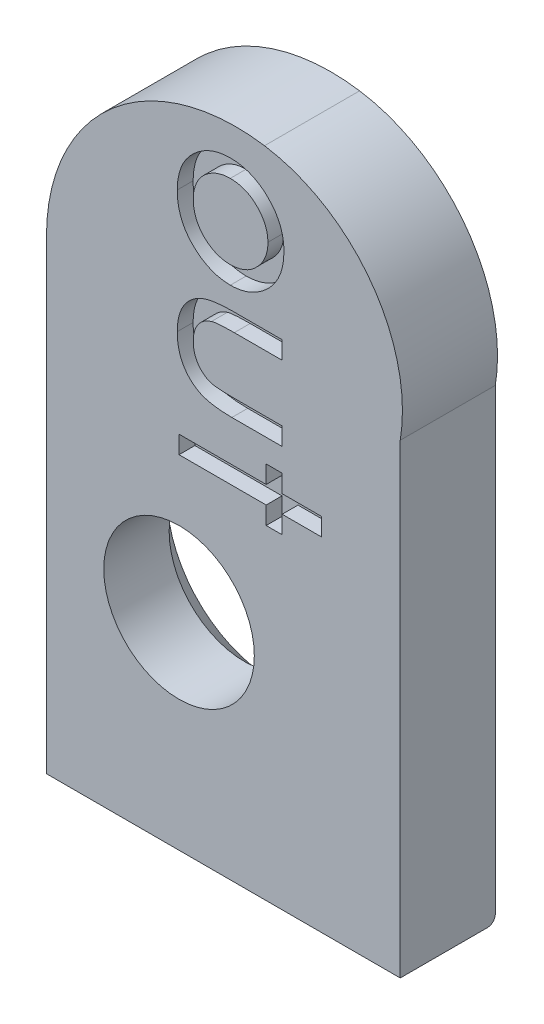
from build123d import *

# Parameters (mm, degrees)
BOSS_EXTRUDE1_DEPTH = 2.4
SKETCH3_R           = 1.9
CUT_EXTRUDE3_DEPTH  = 13.884062313
CHAMFER1_SIZE       = 0.75
CHAMFER1_SIZE2      = 0.804276533
FILLET1_R           = 0.2
CUT_EXTRUDE4_DEPTH  = 0.4
SCALE1_SCALE        = 1.15


with BuildPart() as part:
    # Sketch1 → Boss-Extrude1 (new body)
    with BuildSketch(Plane.XY):
        with BuildLine():
            Line((-3.345730544, 6.552967213), (-3.345730544, -5.2))
            Line((-3.345730544, -5.2), (5.58286968, -5.2))
            Line((5.58286968, -5.2), (5.58286968, 6.552967213))
            ThreePointArc((5.58286968, 6.552967213), (4.857648619, 9.631827975), (2.157036246, 11.27864976))
            ThreePointArc((2.157036246, 11.27864976), (-1.679748439, 10.179691557), (-3.345730544, 6.552967213))
        make_face()
    extrude(amount=BOSS_EXTRUDE1_DEPTH)

    # Sketch3 → Cut-Extrude3 (cut, through all)
    with BuildSketch(Plane.XY):
        Circle(SKETCH3_R)
    extrude(amount=CUT_EXTRUDE3_DEPTH, mode=Mode.SUBTRACT)

    # Chamfer1
    chamfer1_edges = [part.edges().sort_by_distance(p)[0] for p in [
        (-1.9, 0, 0),
    ]]
    chamfer1_side = [part.faces().sort_by_distance(p)[0] for p in [
        (-1.9, 0, 1.2),
    ]]
    chamfer(chamfer1_edges, length=CHAMFER1_SIZE, length2=CHAMFER1_SIZE2, reference=chamfer1_side[0])

    # Fillet1
    fillet1_edges = [part.edges().sort_by_distance(p)[0] for p in [
        (1.118569568, -5.2, 0),
    ]]
    fillet(fillet1_edges, radius=FILLET1_R)

    # Sketch4 → Cut-Extrude4 (cut)
    # profile 1 of 3: a face of its own
    with BuildSketch(Plane.XY.offset(2.4)):
        with BuildLine():
            add(Edge.make_bspline(
                [(2.647435897, 9.21132169), (2.646016509, 9.159380611), (2.643237615, 9.057689783), (2.623603841, 8.908908503), (2.589766857, 8.767767325), (2.542661084, 8.63377309), (2.482190193, 8.506964867), (2.408088648, 8.387623244), (2.320035473, 8.276135537), (2.252484203, 8.208992323), (2.218349359, 8.175063677)],
                knots=[0, 0, 0, 0, 1.078802918, 2.112092493, 3.110573245, 4.088605452, 5.057036471, 6.022908947, 7.000941154, 8, 8, 8, 8], degree=3))
            add(Edge.make_bspline(
                [(2.218349359, 8.175063677), (2.184569367, 8.144899917), (2.118256635, 8.085686126), (2.010267576, 8.010306009), (1.900593289, 7.944088166), (1.786009732, 7.891762285), (1.668525675, 7.849338093), (1.54669492, 7.821707997), (1.421818335, 7.801898341), (1.337120039, 7.800147933), (1.294270833, 7.799262395)],
                knots=[0, 0, 0, 0, 1.062297535, 2.08537206, 3.086585084, 4.066078755, 5.037873789, 6.013379158, 6.994960584, 8, 8, 8, 8], degree=3))
            add(Edge.make_bspline(
                [(1.294270833, 7.799262395), (1.251202095, 7.80049602), (1.165845843, 7.802940892), (1.039756461, 7.821865609), (0.917025605, 7.851795394), (0.798213576, 7.894850209), (0.683191461, 7.95026075), (0.571259587, 8.01673651), (0.463907741, 8.096884941), (0.360824663, 8.186999842), (0.265726104, 8.287143015), (0.182468224, 8.396432417), (0.112009898, 8.513528248), (0.054012972, 8.638219072), (0.010188539, 8.771099555), (-0.022266192, 8.910882456), (-0.041432806, 9.058646195), (-0.04370713, 9.159615844), (-0.044871795, 9.21132169)],
                knots=[0, 0, 0, 0, 0.952871876, 1.888459614, 2.815544184, 3.744891397, 4.679563604, 5.637601804, 6.621431805, 7.640342292, 8.664856555, 9.672479278, 10.67487095, 11.683873433, 12.709444777, 13.765907845, 14.855937143, 16, 16, 16, 16], degree=3))
            add(Edge.make_bspline(
                [(-0.044871795, 9.21132169), (-0.043737537, 9.26070302), (-0.041514065, 9.357504723), (-0.021776537, 9.498962474), (0.008349879, 9.633849602), (0.053152229, 9.761197562), (0.109237379, 9.88200012), (0.17848455, 9.995494765), (0.26029152, 10.101970877), (0.354052874, 10.199876499), (0.455511014, 10.288907022), (0.562416146, 10.367214389), (0.673804765, 10.433670746), (0.789563416, 10.487861182), (0.910007707, 10.529332731), (1.034080697, 10.559712138), (1.162884473, 10.577449191), (1.25004648, 10.5800129), (1.294270833, 10.581313677)],
                knots=[0, 0, 0, 0, 1.108917525, 2.1737994, 3.202961547, 4.209273298, 5.200554843, 6.190221922, 7.190033159, 8.21139688, 9.230909851, 10.219183032, 11.184523317, 12.140594101, 13.085453546, 14.041870314, 15.006482035, 16, 16, 16, 16], degree=3))
            add(Edge.make_bspline(
                [(1.294270833, 10.581313677), (1.338025415, 10.580254315), (1.4242306, 10.57816716), (1.551337962, 10.561058059), (1.673469524, 10.532029213), (1.791613682, 10.492896265), (1.904870868, 10.441221437), (2.013880158, 10.378398153), (2.119044037, 10.304994531), (2.183595601, 10.247775356), (2.216245994, 10.218833709)],
                knots=[0, 0, 0, 0, 1.034079547, 2.037341334, 3.024980457, 3.998111168, 4.974764182, 5.962233312, 6.969290918, 8, 8, 8, 8], degree=3))
            add(Edge.make_bspline(
                [(2.216245994, 10.218833709), (2.250639716, 10.185164682), (2.318444964, 10.11878813), (2.406354353, 10.008305161), (2.481308848, 9.891739892), (2.541580307, 9.7679196), (2.590006813, 9.638289347), (2.623382156, 9.501575469), (2.643223129, 9.358440444), (2.646015323, 9.260931133), (2.647435897, 9.21132169)],
                knots=[0, 0, 0, 0, 1.021997278, 2.014808882, 2.992991082, 3.961403697, 4.935644248, 5.92819495, 6.945935601, 8, 8, 8, 8], degree=3))
        make_face()
        with BuildLine():
            add(Edge.make_bspline(
                [(2.243589744, 9.212723934), (2.242791365, 9.242683232), (2.241206141, 9.302169018), (2.228236003, 9.389787401), (2.207257982, 9.474945884), (2.176816373, 9.556722859), (2.138719646, 9.636304124), (2.09157422, 9.712377542), (2.036278699, 9.786124176), (1.973084348, 9.855958869), (1.90392265, 9.920894669), (1.829022543, 9.977284674), (1.750123928, 10.025231456), (1.667090995, 10.06484724), (1.579296834, 10.095094061), (1.487425402, 10.116494669), (1.391221946, 10.130531584), (1.325638139, 10.131898251), (1.292167468, 10.132595729)],
                knots=[0, 0, 0, 0, 0.977091595, 1.940067522, 2.883247161, 3.833734333, 4.781832803, 5.75743561, 6.748705817, 7.785334412, 8.826635868, 9.839261104, 10.838360171, 11.834311728, 12.83506799, 13.861550998, 14.908643384, 16, 16, 16, 16], degree=3))
            add(Edge.make_bspline(
                [(1.292167468, 10.132595729), (1.248596982, 10.130902326), (1.162893832, 10.127571402), (1.036872122, 10.10337894), (0.9171942, 10.061281852), (0.803986704, 10.004896535), (0.701008297, 9.935233572), (0.609744005, 9.855137944), (0.532171061, 9.765078783), (0.468968314, 9.665658077), (0.419795706, 9.559420828), (0.38473453, 9.447965014), (0.362835267, 9.331836543), (0.360272878, 9.252784467), (0.358974359, 9.212723934)],
                knots=[0, 0, 0, 0, 1.073619824, 2.111810325, 3.148337621, 4.191629042, 5.220493544, 6.20400006, 7.176156379, 8.139690794, 9.098392143, 10.052983528, 11.013327394, 12, 12, 12, 12], degree=3))
            add(Edge.make_bspline(
                [(0.358974359, 9.212723934), (0.360455055, 9.169387628), (0.363372844, 9.083991148), (0.386563068, 8.958916269), (0.423797639, 8.839470034), (0.475691764, 8.726489419), (0.541434524, 8.621637498), (0.621223572, 8.527877868), (0.713736138, 8.445705619), (0.816855702, 8.375345454), (0.92874096, 8.318526608), (1.046164237, 8.277733745), (1.16797497, 8.25299067), (1.250453797, 8.249663208), (1.292167468, 8.247980344)],
                knots=[0, 0, 0, 0, 1.042880454, 2.055051067, 3.051726387, 4.048830532, 5.040201766, 6.022282375, 7.002717173, 8.011000956, 9.020163719, 10.014978664, 10.996075346, 12, 12, 12, 12], degree=3))
            add(Edge.make_bspline(
                [(1.292167468, 8.247980344), (1.324466638, 8.248711582), (1.388181078, 8.250154048), (1.481922858, 8.263921162), (1.572187569, 8.286266018), (1.658576211, 8.318014618), (1.741373901, 8.358233372), (1.820285768, 8.407664952), (1.89533782, 8.466280076), (1.96632632, 8.532313866), (2.031196809, 8.604761769), (2.088053962, 8.681758466), (2.135869043, 8.762220274), (2.175922251, 8.845477259), (2.2057237, 8.93270066), (2.22754647, 9.023037493), (2.241444833, 9.116706794), (2.242868191, 9.180423576), (2.243589744, 9.212723934)],
                knots=[0, 0, 0, 0, 1.029228639, 2.03029134, 3.013390026, 3.989290165, 4.959026663, 5.943141356, 6.952158769, 7.990757771, 9.030318538, 10.048183427, 11.037250238, 12.010472849, 12.988390516, 13.96970866, 14.970771361, 16, 16, 16, 16], degree=3))
        make_face(mode=Mode.SUBTRACT)
    # profile 2 of 3: a face of its own
    with BuildSketch(Plane.XY.offset(2.4)):
        with BuildLine():
            Line((2.602564103, 7.260800857), (2.602564103, 6.812082908))
            Line((2.602564103, 6.812082908), (1.39453125, 6.812082908))
            add(Edge.make_bspline(
                [(1.39453125, 6.812082908), (1.360409421, 6.81195121), (1.294963184, 6.811698611), (1.200989926, 6.809719185), (1.115938164, 6.805941689), (1.039645717, 6.802431216), (0.972397988, 6.795587336), (0.913538224, 6.789341591), (0.863718774, 6.780253562), (0.833835778, 6.772722564), (0.8203125, 6.769314479)],
                knots=[0, 0, 0, 0, 1.418944939, 2.721560048, 3.90822129, 4.959445687, 5.896519748, 6.718644391, 7.420134194, 8, 8, 8, 8], degree=3))
            add(Edge.make_bspline(
                [(0.8203125, 6.769314479), (0.78401576, 6.756501928), (0.713856349, 6.73173604), (0.619535206, 6.675349269), (0.538368362, 6.607286304), (0.472899892, 6.525231078), (0.421262545, 6.433851532), (0.385917311, 6.33310441), (0.362273122, 6.225170957), (0.360092074, 6.150122214), (0.358974359, 6.111662235)],
                knots=[0, 0, 0, 0, 1.064665383, 2.057934019, 3.027620532, 3.985747325, 4.951617696, 5.922969057, 6.935590871, 8, 8, 8, 8], degree=3))
            add(Edge.make_bspline(
                [(0.358974359, 6.111662235), (0.36039748, 6.069721107), (0.363146553, 5.988702522), (0.38592072, 5.872157646), (0.423747703, 5.765473977), (0.477287866, 5.670241201), (0.542501708, 5.586763769), (0.618610024, 5.517796981), (0.702648981, 5.460141727), (0.765502132, 5.435552026), (0.797175481, 5.423160632)],
                knots=[0, 0, 0, 0, 1.152443788, 2.226200606, 3.2506767, 4.251830982, 5.217310063, 6.149716414, 7.067593649, 8, 8, 8, 8], degree=3))
            add(Edge.make_bspline(
                [(0.797175481, 5.423160632), (0.81043133, 5.419143686), (0.839848706, 5.410229281), (0.890085894, 5.402272317), (0.949565523, 5.393274635), (1.019398747, 5.387819484), (1.099039251, 5.381699756), (1.188852052, 5.378729326), (1.288415952, 5.376509533), (1.358071035, 5.376296817), (1.39453125, 5.376185472)],
                knots=[0, 0, 0, 0, 0.552623276, 1.226381414, 2.027670893, 2.955584593, 4.022320098, 5.218031084, 6.543807858, 8, 8, 8, 8], degree=3))
            Line((1.39453125, 5.376185472), (2.602564103, 5.376185472))
            Line((2.602564103, 5.376185472), (2.602564103, 4.927467523))
            Line((2.602564103, 4.927467523), (1.333533654, 4.927467523))
            add(Edge.make_bspline(
                [(1.333533654, 4.927467523), (1.291928332, 4.927917879), (1.211016153, 4.928793712), (1.093588996, 4.934198193), (0.983630601, 4.943921733), (0.88162571, 4.957806909), (0.787109744, 4.975409965), (0.700259241, 4.99587099), (0.621038806, 5.021236659), (0.548854542, 5.050853581), (0.48235351, 5.084800007), (0.420236856, 5.123118933), (0.36100772, 5.165266371), (0.305026809, 5.211967637), (0.253039704, 5.263796076), (0.203561547, 5.319115099), (0.158210363, 5.379618364), (0.116034079, 5.444109326), (0.077821404, 5.513033952), (0.045326796, 5.586640374), (0.016638663, 5.664188369), (-0.004969704, 5.74632681), (-0.023852052, 5.832261511), (-0.036118759, 5.922524584), (-0.042997046, 6.017136131), (-0.044236849, 6.081502511), (-0.044871795, 6.114466722)],
                knots=[0, 0, 0, 0, 1.433159705, 2.787145272, 4.048041634, 5.234364305, 6.331720084, 7.358758656, 8.30582621, 9.193845734, 10.043525955, 10.874699125, 11.705716338, 12.545769774, 13.382576764, 14.232295121, 15.100125131, 15.984341555, 16.88511397, 17.811215238, 18.753480536, 19.729960937, 20.73415514, 21.782706832, 22.864448818, 24, 24, 24, 24], degree=3))
            add(Edge.make_bspline(
                [(-0.044871795, 6.114466722), (-0.044619273, 6.145569907), (-0.044124781, 6.20647674), (-0.035817194, 6.295611112), (-0.024139549, 6.381101261), (-0.007606239, 6.462703335), (0.01447872, 6.54063823), (0.040844566, 6.614809876), (0.072405008, 6.68520613), (0.109185511, 6.751303571), (0.149787377, 6.813565091), (0.193939041, 6.872243084), (0.242775744, 6.926107217), (0.294244691, 6.976849125), (0.350420835, 7.022571534), (0.409607148, 7.064817329), (0.473376744, 7.101699526), (0.540561993, 7.136277604), (0.614578759, 7.165707202), (0.69605284, 7.191669611), (0.785848989, 7.213110009), (0.883986195, 7.230429291), (0.990179315, 7.244389667), (1.105048469, 7.254074346), (1.228078902, 7.259480794), (1.312962111, 7.260352165), (1.356670673, 7.260800857)],
                knots=[0, 0, 0, 0, 1.07597169, 2.106987754, 3.095241919, 4.061236383, 4.985566203, 5.896314517, 6.783228071, 7.652071766, 8.511262394, 9.354041321, 10.190274899, 11.025334265, 11.852760172, 12.694257424, 13.539013297, 14.39987728, 15.307027207, 16.291800133, 17.356987241, 18.49925168, 19.739217286, 21.062407783, 22.487357717, 24, 24, 24, 24], degree=3))
            Line((1.356670673, 7.260800857), (2.602564103, 7.260800857))
        make_face()
    # profile 3 of 3: a face of its own
    with BuildSketch(Plane.XY.offset(2.4)):
        Polygon((3.58974359, 3.895416241), (3.58974359, 3.446698293), (2.602564103, 3.446698293), (2.602564103, 2.997980344), (2.198717949, 2.997980344), (2.198717949, 3.446698293), (0, 3.446698293), (0, 3.895416241), (2.198717949, 3.895416241), (2.198717949, 4.34413419), (2.602564103, 4.34413419), (2.602564103, 3.895416241), align=None)
    extrude(amount=-CUT_EXTRUDE4_DEPTH, mode=Mode.SUBTRACT)


with BuildPart() as part_1:
    # Scale1: scaled about (1.270043316, 2.866904373, 1.203100921)
    add(part.part.scale(SCALE1_SCALE).moved(Location((-0.190506497, -0.430035656, -0.180465138))))


solid = part_1.part
